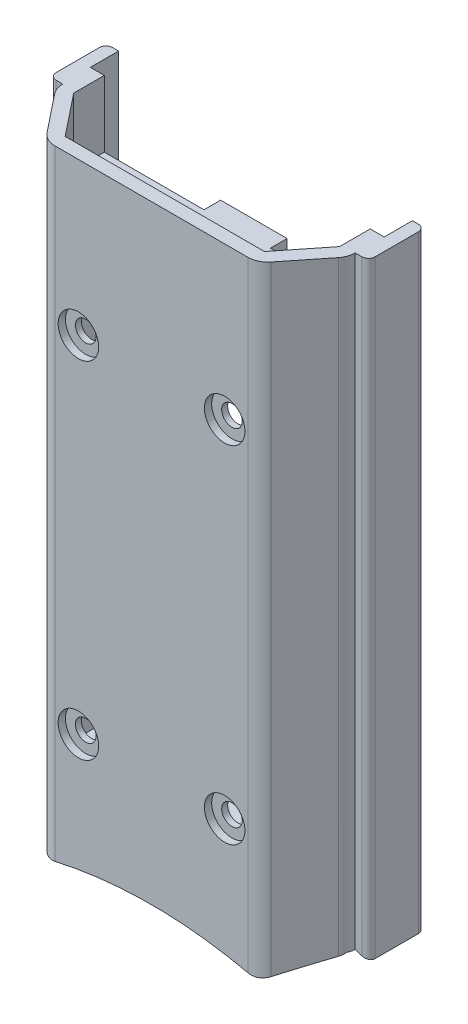
from build123d import *
from OCP.BRepAlgoAPI import BRepAlgoAPI_Cut
from OCP.TopTools import TopTools_ListOfShape

# Parameters (mm, degrees)
EXTRUDE_1_DEPTH     = 58.89737674
EXTRUDE_START       = 38.399597665
EXTRUDE_2_DEPTH     = 38.399597665
EXTRUDE_3_REACH     = 66.893
SKETCH_3_W          = 44.2
SKETCH_3_H          = 3
EXTRUDE_4_REACH     = 66.893
SKETCH_4_W          = 44.2
SKETCH_4_H          = 3
CUT_EXTRUDE_START   = -77.29697691
CUT_EXTRUDE_1_DEPTH = 77.29697691
SKETCH_6_W          = 16.122631446
SKETCH_6_H          = 4.394864928
CUT_EXTRUDE_2_DEPTH = 3
EXTRUDE_START_2     = 15
EXTRUDE_5_DEPTH     = 15
SKETCH_11_R         = 3.05
CUT_EXTRUDE_4_DEPTH = 1.1
CUT_EXTRUDE_START_2 = -10
CUT_EXTRUDE_5_DEPTH = 10
SKETCH_14_R         = 1.55
CUT_EXTRUDE_6_DEPTH = 57.783530783
SKETCH_15_W         = 16.122631446
SKETCH_15_H         = 3
CUT_EXTRUDE_7_DEPTH = 0.5
SKETCH_16_W         = 10
SKETCH_16_H         = 3
EXTRUDE_6_DEPTH     = 2.5
SKETCH_17_W         = 14.4
SKETCH_17_H         = 5.4
CUT_EXTRUDE_8_DEPTH = 1


with BuildPart() as part:
    # 草图1 → 凸台-拉伸1 (new body)
    with BuildSketch(Plane(origin=(0, 0, 0), x_dir=(1, 0, 0), z_dir=(0, 1, 0))):
        with BuildLine():
            Line((21.346642729, -10.719560241), (16.852020459, -16.362765964))
            ThreePointArc((16.852020459, -16.362765964), (15.807857901, -17.196247295), (14.505374257, -17.493741725))
            Line((14.505374257, -17.493741725), (-14.505381202, -17.493741725))
            ThreePointArc((-14.505381202, -17.493741725), (-15.807864846, -17.196247295), (-16.852027404, -16.362765964))
            Line((-16.852027404, -16.362765964), (-21.346649674, -10.719560241))
            ThreePointArc((-21.346649674, -10.719560241), (-21.831958504, -9.840501001), (-22.000003473, -8.850536003))
            Line((-22.000003473, -8.850536003), (-23.000003473, -8.850536003))
            ThreePointArc((-23.000003473, -8.850536003), (-23.707110254, -8.557642784), (-24.000003473, -7.850536003))
            Line((-24.000003473, -7.850536003), (-24.000003473, -1.349569462))
            ThreePointArc((-24.000003473, -1.349569462), (-23.707110254, -0.642462681), (-23.000003473, -0.349569462))
            Line((-23.000003473, -0.349569462), (-22.100003473, -0.349569462))
            Line((-22.100003473, -0.349569462), (-22.100003473, -4.600052733))
            Line((-22.100003473, -4.600052733), (-22.000003473, -4.600052733))
            Line((-22.000003473, -4.600052733), (-20.000003473, -4.600052733))
            Line((-20.000003473, -4.600052733), (-20.000003473, -9.200105465))
            Line((-20.000003473, -9.200105465), (-14.987335304, -15.493741725))
            Line((-14.987335304, -15.493741725), (14.987328359, -15.493741725))
            Line((14.987328359, -15.493741725), (19.999996527, -9.200105465))
            Line((19.999996527, -9.200105465), (19.999996527, -4.600052733))
            Line((19.999996527, -4.600052733), (21.999996527, -4.600052733))
            Line((21.999996527, -4.600052733), (22.099996527, -4.600052733))
            Line((22.099996527, -4.600052733), (22.099996527, -0.349569462))
            Line((22.099996527, -0.349569462), (22.999996527, -0.349569462))
            ThreePointArc((22.999996527, -0.349569462), (23.707103309, -0.642462681), (23.999996527, -1.349569462))
            Line((23.999996527, -1.349569462), (23.999996527, -7.850536003))
            ThreePointArc((23.999996527, -7.850536003), (23.707103309, -8.557642784), (22.999996527, -8.850536003))
            Line((22.999996527, -8.850536003), (21.999996527, -8.850536003))
            ThreePointArc((21.999996527, -8.850536003), (21.831951559, -9.840501001), (21.346642729, -10.719560241))
        make_face()
    extrude(amount=EXTRUDE_1_DEPTH)

    # 草图2 → 凸台-拉伸2 (add)
    with BuildSketch(Plane.XZ.offset(EXTRUDE_START)):
        with BuildLine():
            Line((22.999996527, 8.850536003), (21.999996527, 8.850536003))
            ThreePointArc((21.999996527, 8.850536003), (21.831951559, 9.840501001), (21.346642729, 10.719560241))
            Line((21.346642729, 10.719560241), (16.852020459, 16.362765964))
            ThreePointArc((16.852020459, 16.362765964), (15.807857901, 17.196247295), (14.505374257, 17.493741725))
            Line((14.505374257, 17.493741725), (-14.505381202, 17.493741725))
            ThreePointArc((-14.505381202, 17.493741725), (-15.807864846, 17.196247295), (-16.852027404, 16.362765964))
            Line((-16.852027404, 16.362765964), (-21.346649674, 10.719560241))
            ThreePointArc((-21.346649674, 10.719560241), (-21.831958504, 9.840501001), (-22.000003473, 8.850536003))
            Line((-22.000003473, 8.850536003), (-23.000003473, 8.850536003))
            ThreePointArc((-23.000003473, 8.850536003), (-23.707110254, 8.557642784), (-24.000003473, 7.850536003))
            Line((-24.000003473, 7.850536003), (-24.000003473, 1.349569462))
            ThreePointArc((-24.000003473, 1.349569462), (-23.707110254, 0.642462681), (-23.000003473, 0.349569462))
            Line((-23.000003473, 0.349569462), (-22.100003473, 0.349569462))
            Line((-22.100003473, 0.349569462), (-22.100003473, 4.600052733))
            Line((-22.100003473, 4.600052733), (-20.000003473, 4.600052733))
            Line((-20.000003473, 4.600052733), (-20.000003473, 9.200105465))
            Line((-20.000003473, 9.200105465), (-14.987335304, 15.493741725))
            Line((-14.987335304, 15.493741725), (14.987328359, 15.493741725))
            Line((14.987328359, 15.493741725), (19.999996527, 9.200105465))
            Line((19.999996527, 9.200105465), (19.999996527, 4.600052733))
            Line((19.999996527, 4.600052733), (22.099996527, 4.600052733))
            Line((22.099996527, 4.600052733), (22.099996527, 0.349569462))
            Line((22.099996527, 0.349569462), (22.999996527, 0.349569462))
            ThreePointArc((22.999996527, 0.349569462), (23.707103309, 0.642462681), (23.999996527, 1.349569462))
            Line((23.999996527, 1.349569462), (23.999996527, 7.850536003))
            ThreePointArc((23.999996527, 7.850536003), (23.707103309, 8.557642784), (22.999996527, 8.850536003))
        make_face()
    extrude(amount=-EXTRUDE_2_DEPTH)

    # 凸台-拉伸3: up to this face of the body (flat: up to its plane)
    extrude_3_end = Plane(part.part.faces().sort_by_distance((-3.473e-06, 10.248889538, 17.493741725))[0])
    # 草图3 → 凸台-拉伸3 (add, up to the picked face)
    with BuildSketch(Plane(origin=(0, 0, 4.600052733), x_dir=(-1, 0, 0), z_dir=(0, 0, -1)), mode=Mode.PRIVATE) as extrude_3_sk1:
        with Locations((3.473e-06, -36.899597665)):
            Rectangle(SKETCH_3_W, SKETCH_3_H)
    extrude_3_tool1 = split(extrude(extrude_3_sk1.sketch, amount=-EXTRUDE_3_REACH, mode=Mode.PRIVATE), bisect_by=extrude_3_end, keep=Keep.BOTH, mode=Mode.PRIVATE)
    add(extrude_3_tool1.solids().sort_by(Axis((-3e-06, -36.899598, 4.600053), (0, 0, 1)))[0])

    # 凸台-拉伸4: up to this face of the body (flat: up to its plane)
    extrude_4_end = Plane(part.part.faces().sort_by_distance((-3.473e-06, 9.499837909, 17.493741725))[0])
    # 草图4 → 凸台-拉伸4 (add, up to the picked face)
    with BuildSketch(Plane(origin=(0, 0, 4.600052733), x_dir=(-1, 0, 0), z_dir=(0, 0, -1)), mode=Mode.PRIVATE) as extrude_4_sk1:
        with Locations((3.473e-06, 37.397379245)):
            Rectangle(SKETCH_4_W, SKETCH_4_H)
    extrude_4_tool1 = split(extrude(extrude_4_sk1.sketch, amount=-EXTRUDE_4_REACH, mode=Mode.PRIVATE), bisect_by=extrude_4_end, keep=Keep.BOTH, mode=Mode.PRIVATE)
    add(extrude_4_tool1.solids().sort_by(Axis((-3e-06, 37.397379, 4.600053), (0, 0, 1)))[0])

    # 草图5 → 切除-拉伸1 (cut)
    with BuildSketch(Plane(origin=(0, 38.897379245, 0), x_dir=(1, 0, 0), z_dir=(0, 1, 0)).offset(CUT_EXTRUDE_START)):
        with BuildLine():
            Line((-22.100003473, -8.850536003), (-22.100003473, -17.493741725))
            Line((-22.100003473, -17.493741725), (-14.505381202, -17.493741725))
            ThreePointArc((-14.505381202, -17.493741725), (-15.807864846, -17.196247295), (-16.852027404, -16.362765964))
            Line((-16.852027404, -16.362765964), (-21.346649674, -10.719560241))
            ThreePointArc((-21.346649674, -10.719560241), (-21.831958504, -9.840501001), (-22.000003473, -8.850536003))
            Line((-22.000003473, -8.850536003), (-22.100003473, -8.850536003))
        make_face()
        with BuildLine():
            Line((14.505374257, -17.493741725), (22.099996527, -17.493741725))
            Line((22.099996527, -17.493741725), (22.099996527, -8.850536003))
            Line((22.099996527, -8.850536003), (21.999996527, -8.850536003))
            ThreePointArc((21.999996527, -8.850536003), (21.831951559, -9.840501001), (21.346642729, -10.719560241))
            Line((21.346642729, -10.719560241), (16.852020459, -16.362765964))
            ThreePointArc((16.852020459, -16.362765964), (15.807857901, -17.196247295), (14.505374257, -17.493741725))
        make_face()
    extrude(amount=CUT_EXTRUDE_1_DEPTH, mode=Mode.SUBTRACT)

    # 草图6 → 切除-拉伸2 (cut)
    with BuildSketch(Plane(origin=(0, 38.897379245, 0), x_dir=(1, 0, 0), z_dir=(0, 1, 0))):
        with Locations((0, -9.597483264)):
            Rectangle(SKETCH_6_W, SKETCH_6_H)
    extrude(amount=-CUT_EXTRUDE_2_DEPTH, mode=Mode.SUBTRACT)

    # 草图7 → 凸台-拉伸5 (add)
    with BuildSketch(Plane(origin=(0, -38.399597665, 0), x_dir=(-1, 0, 0), z_dir=(0, -1, 0)).offset(EXTRUDE_START_2)):
        with BuildLine():
            Line((20.000003473, -4.600052733), (20.000003473, -9.200105465))
            Line((20.000003473, -9.200105465), (14.987335304, -15.493741725))
            Line((14.987335304, -15.493741725), (-14.987328359, -15.493741725))
            Line((-14.987328359, -15.493741725), (-19.999996527, -9.200105465))
            Line((-19.999996527, -9.200105465), (-19.999996527, -4.600052733))
            Line((-19.999996527, -4.600052733), (-21.999996527, -4.600052733))
            Line((-21.999996527, -4.600052733), (-22.099996527, -4.600052733))
            Line((-22.099996527, -4.600052733), (-22.099996527, -0.349569462))
            Line((-22.099996527, -0.349569462), (-22.999996527, -0.349569462))
            ThreePointArc((-22.999996527, -0.349569462), (-23.707103309, -0.642462681), (-23.999996527, -1.349569462))
            Line((-23.999996527, -1.349569462), (-23.999996527, -7.850536003))
            ThreePointArc((-23.999996527, -7.850536003), (-23.707103309, -8.557642784), (-22.999996527, -8.850536003))
            Line((-22.999996527, -8.850536003), (-21.999996527, -8.850536003))
            ThreePointArc((-21.999996527, -8.850536003), (-21.831951559, -9.840501001), (-21.346642729, -10.719560241))
            Line((-21.346642729, -10.719560241), (-16.852020459, -16.362765964))
            ThreePointArc((-16.852020459, -16.362765964), (-15.807857901, -17.196247295), (-14.505374257, -17.493741725))
            Line((-14.505374257, -17.493741725), (14.505381202, -17.493741725))
            ThreePointArc((14.505381202, -17.493741725), (15.807864846, -17.196247295), (16.852027404, -16.362765964))
            Line((16.852027404, -16.362765964), (21.346649674, -10.719560241))
            ThreePointArc((21.346649674, -10.719560241), (21.831958504, -9.840501001), (22.000003473, -8.850536003))
            Line((22.000003473, -8.850536003), (23.000003473, -8.850536003))
            ThreePointArc((23.000003473, -8.850536003), (23.707110254, -8.557642784), (24.000003473, -7.850536003))
            Line((24.000003473, -7.850536003), (24.000003473, -1.349569462))
            ThreePointArc((24.000003473, -1.349569462), (23.707110254, -0.642462681), (23.000003473, -0.349569462))
            Line((23.000003473, -0.349569462), (22.100003473, -0.349569462))
            Line((22.100003473, -0.349569462), (22.100003473, -4.600052733))
            Line((22.100003473, -4.600052733), (22.000003473, -4.600052733))
            Line((22.000003473, -4.600052733), (20.000003473, -4.600052733))
        make_face()
    extrude(amount=-EXTRUDE_5_DEPTH)

    # 草图8 → 切除-旋转1 (revolve, cut)
    with BuildSketch(Plane(origin=(0, 0, 0), x_dir=(0, 0, -1), z_dir=(1, 0, 0))):
        Polygon((-9.89924439, -38.299597665), (-20.291549236, -44.299597665), (-20.291549236, -55.801852499), (11.09144377, -55.801852499), (11.09144377, -44.299597665), (0.699138925, -38.299597665), align=None)
    revolve(axis=Axis((0, -108.399597665, 9.89924439), (0, 0, -1)), mode=Mode.SUBTRACT)

    # 草图11 → 切除-拉伸4 (cut)
    with BuildSketch(Plane.XY.offset(17.493741725)):
        with Locations((-11.00002286, 26.0000508)):
            Circle(SKETCH_11_R)
        with Locations((11.00002032, 26.0000508)):
            Circle(SKETCH_11_R)
        with Locations((-11.00002286, -26.00005334)):
            Circle(SKETCH_11_R)
        with Locations((11.00002032, -26.00005334)):
            Circle(SKETCH_11_R)
    extrude(amount=-CUT_EXTRUDE_4_DEPTH, mode=Mode.SUBTRACT)


with BuildPart() as cut_extrude_5_tool:
    # 草图13 → 切除-拉伸5 (new body)
    with BuildSketch(Plane(origin=(-3.473e-06, 58.897378066, 0), x_dir=(0.9999999999999983, 5.895855893701837e-08, 0), z_dir=(-5.895855893701837e-08, 0.9999999999999983, 0)).offset(CUT_EXTRUDE_START_2)):
        with BuildLine():
            Line((-23, -8.850536003), (-22, -8.850536003))
            ThreePointArc((-22, -8.850536003), (-21.831955032, -9.840501001), (-21.346646202, -10.719560241))
            Line((-21.346646202, -10.719560241), (-16.852023931, -16.362765964))
            ThreePointArc((-16.852023931, -16.362765964), (-15.807861373, -17.196247295), (-14.50537773, -17.493741725))
            Line((-14.50537773, -17.493741725), (14.50537773, -17.493741725))
            ThreePointArc((14.50537773, -17.493741725), (15.807861373, -17.196247295), (16.852023931, -16.362765964))
            Line((16.852023931, -16.362765964), (21.346646202, -10.719560241))
            ThreePointArc((21.346646202, -10.719560241), (21.831955032, -9.840501001), (22, -8.850536003))
            Line((22, -8.850536003), (23, -8.850536003))
            ThreePointArc((23, -8.850536003), (23.707106781, -8.557642784), (24, -7.850536003))
            Line((24, -7.850536003), (24, -1.349569462))
            ThreePointArc((24, -1.349569462), (23.707106781, -0.642462681), (23, -0.349569462))
            Line((23, -0.349569462), (22.1, -0.349569462))
            Line((22.1, -0.349569462), (22.1, -4.600052733))
            Line((22.1, -4.600052733), (20, -4.600052733))
            Line((20, -4.600052733), (20, -9.200105465))
            Line((20, -9.200105465), (14.987331831, -15.493741725))
            Line((14.987331831, -15.493741725), (-14.987331831, -15.493741725))
            Line((-14.987331831, -15.493741725), (-20, -9.200105465))
            Line((-20, -9.200105465), (-20, -4.600052733))
            Line((-20, -4.600052733), (-22.1, -4.600052733))
            Line((-22.1, -4.600052733), (-22.1, -0.349569462))
            Line((-22.1, -0.349569462), (-23, -0.349569462))
            ThreePointArc((-23, -0.349569462), (-23.707106781, -0.642462681), (-24, -1.349569462))
            Line((-24, -1.349569462), (-24, -7.850536003))
            ThreePointArc((-24, -7.850536003), (-23.707106781, -8.557642784), (-23, -8.850536003))
        make_face()
    extrude(amount=CUT_EXTRUDE_5_DEPTH)


with BuildPart() as part_1:
    add(part.part)

    # 切除-拉伸5: cut by cut_extrude_5_tool, with a tolerance
    cut_extrude_5_stock = TopTools_ListOfShape()
    cut_extrude_5_stock.Append(part_1.part.wrapped)
    cut_extrude_5_tools = TopTools_ListOfShape()
    cut_extrude_5_tools.Append(cut_extrude_5_tool.part.wrapped)
    cut_extrude_5_cut = BRepAlgoAPI_Cut()
    cut_extrude_5_cut.SetArguments(cut_extrude_5_stock)
    cut_extrude_5_cut.SetTools(cut_extrude_5_tools)
    cut_extrude_5_cut.SetFuzzyValue(0.00001)
    cut_extrude_5_cut.Build()
    add(Compound.cast(cut_extrude_5_cut.Shape()).solids(), mode=Mode.REPLACE)

    # 草图14 → 切除-拉伸6 (cut, through all)
    with BuildSketch(Plane.XY.offset(16.393741725)):
        with Locations((-11.00002286, 26.0000508)):
            Circle(SKETCH_14_R)
        with Locations((11.00002032, 26.0000508)):
            Circle(SKETCH_14_R)
        with Locations((-11.00002286, -26.00005334)):
            Circle(SKETCH_14_R)
        with Locations((11.00002032, -26.00005334)):
            Circle(SKETCH_14_R)
    extrude(amount=-CUT_EXTRUDE_6_DEPTH, mode=Mode.SUBTRACT)

    # 草图15 → 切除-拉伸7 (cut)
    with BuildSketch(Plane(origin=(0, 0, 11.794915728), x_dir=(-1, 0, 0), z_dir=(0, 0, -1))):
        with Locations((0, 37.397379245)):
            Rectangle(SKETCH_15_W, SKETCH_15_H)
    extrude(amount=-CUT_EXTRUDE_7_DEPTH, mode=Mode.SUBTRACT)

    # 草图16 → 凸台-拉伸6 (add)
    with BuildSketch(Plane(origin=(0, 0, 4.600052733), x_dir=(-1, 0, 0), z_dir=(0, 0, -1))):
        with Locations((3.473e-06, 37.397379245)):
            Rectangle(SKETCH_16_W, SKETCH_16_H)
    extrude(amount=EXTRUDE_6_DEPTH)

    # 草图17 → 切除-拉伸8 (cut)
    with BuildSketch(Plane(origin=(0, 0, 15.493741725), x_dir=(-1, 0, 0), z_dir=(0, 0, -1))):
        with Locations((2.883e-06, 43.397377654)):
            Rectangle(SKETCH_17_W, SKETCH_17_H)
    extrude(amount=-CUT_EXTRUDE_8_DEPTH, mode=Mode.SUBTRACT)


solid = part_1.part
